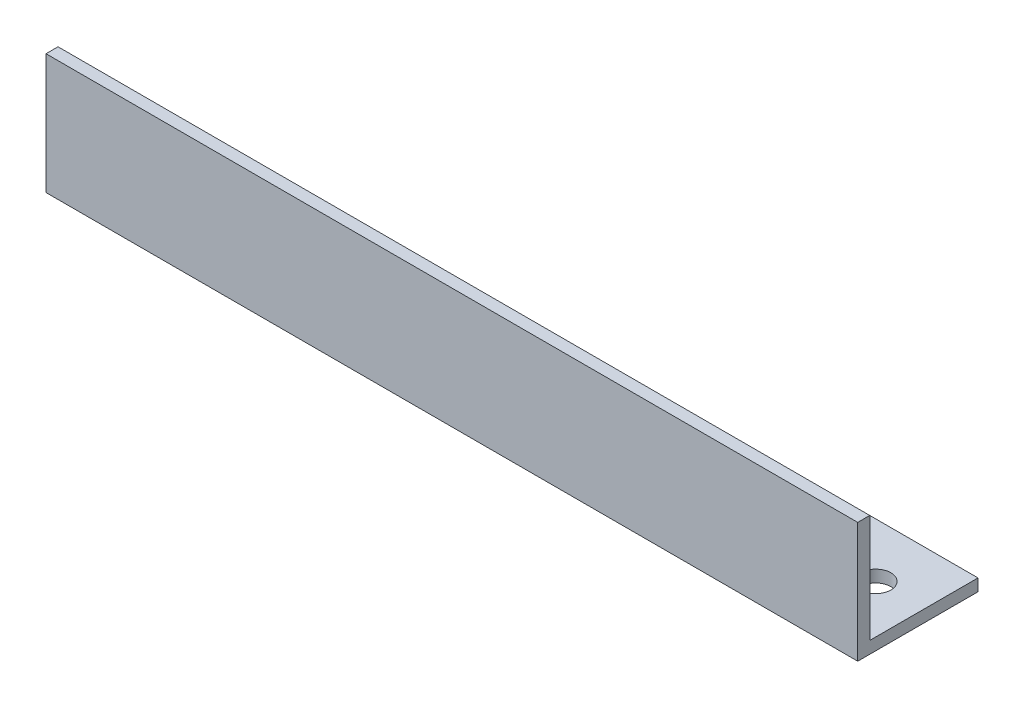
from build123d import *

# Parameters (mm, degrees)
BOSS_EXTRUDE1_DEPTH = 135
SKETCH3_R           = 2.5
CUT_EXTRUDE1_DEPTH  = 2


with BuildPart() as part:
    # Sketch1 → Boss-Extrude1 (new body)
    with BuildSketch(Plane(origin=(0, 0, 0), x_dir=(0, 0, -1), z_dir=(1, 0, 0))):
        Polygon((0, 20), (0, 0), (20, 0), (20, 2), (2, 2), (2, 20), align=None)
    extrude(amount=-BOSS_EXTRUDE1_DEPTH)

    # Sketch3 → Cut-Extrude1 (cut)
    with BuildSketch(Plane(origin=(0, 2, 0), x_dir=(1, 0, 0), z_dir=(0, 1, 0))):
        with Locations((-8, 11)):
            Circle(SKETCH3_R)
        with Locations((-30, 11)):
            Circle(SKETCH3_R)
    extrude(amount=-CUT_EXTRUDE1_DEPTH, mode=Mode.SUBTRACT)


solid = part.part
